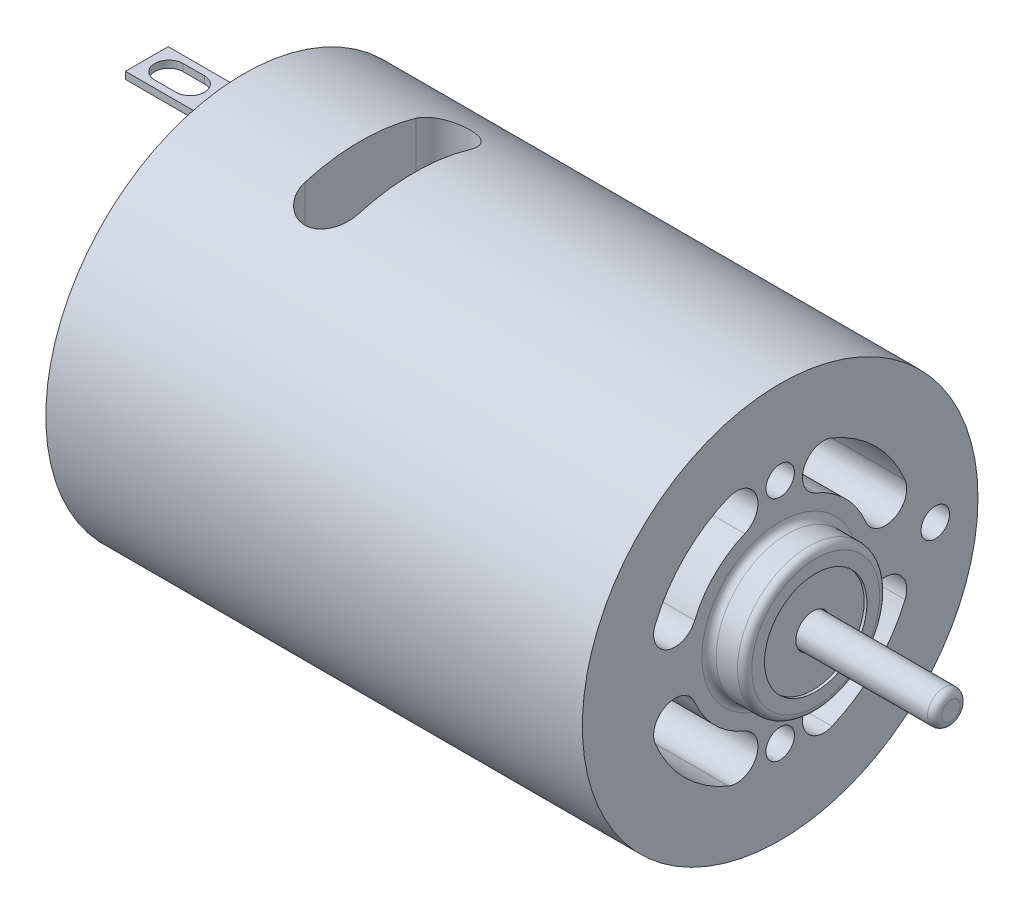
from build123d import *

# Parameters (mm, degrees)
SKETCH_1_R               = 13.9
EXTRUDE_1_DEPTH          = 37.7
CUT_EXTRUDE_1_DEPTH      = 43.517173001
CUT_EXTRUDE_1_DEPTH_BACK = 43.517173001
SKETCH_3_R               = 13.7
CUT_EXTRUDE_2_DEPTH      = 1
EXTRUDE_START            = 1
EXTRUDE_7_DEPTH          = 1
SKETCH_6_4_W             = 3
SKETCH_6_4_H             = 0.5
EXTRUDE_8_DEPTH          = 6.8
CUT_EXTRUDE_4_DEPTH      = 48.482523263
SKETCH_4_W               = 17.082447132
SKETCH_4_H               = 17
EXTRUDE_2_DEPTH          = 1
SKETCH_5_R               = 1.15
EXTRUDE_3_DEPTH          = 4
SKETCH_5_3_R             = 5
EXTRUDE_4_DEPTH          = 2
SKETCH_5_4_R             = 3
EXTRUDE_5_DEPTH          = 3
CUT_EXTRUDE_START        = 1
SKETCH_5_5_R             = 2.25
SKETCH_5_5_R_2           = 1.15
CUT_EXTRUDE_3_DEPTH      = 2
FILLET_1_R               = 1
FILLET_2_R               = 1
FILLET_3_R               = 0.5
EXTRUDE_START_2          = 2.5
SKETCH_8_R               = 5
SKETCH_8_R_2             = 3.6
EXTRUDE_9_DEPTH          = 2.5
EXTRUDE_START_3          = 2.3
SKETCH_8_3_R             = 3.6
SKETCH_8_3_R_2           = 1.2
EXTRUDE_10_DEPTH         = 2.3
EXTRUDE_START_4          = 12
SKETCH_8_4_R             = 1.15
EXTRUDE_11_DEPTH         = 12
FILLET_4_R               = 0.5
FILLET_5_R               = 0.5
FILLET_6_R               = 0.5
SKETCH_9_R               = 1
CUT_EXTRUDE_5_DEPTH      = 10
CUT_EXTRUDE_START_2      = -10
CUT_EXTRUDE_6_DEPTH      = 10
CHAMFER_1_SIZE           = 1


with BuildPart() as part:
    # 草图1 → 凸台-拉伸1 (new body)
    with BuildSketch(Plane(origin=(0, 0, 0), x_dir=(0, 0, -1), z_dir=(1, 0, 0))):
        Circle(SKETCH_1_R)
    extrude(amount=EXTRUDE_1_DEPTH)

    # 草图2 → 切除-拉伸1 (cut, two sides: drawn at the far end of the back side and taken through both)
    with BuildSketch(Plane(origin=(0, 0, 0), x_dir=(1, 0, 0), z_dir=(0, 1, 0)).offset(-CUT_EXTRUDE_1_DEPTH_BACK)):
        with BuildLine():
            Line((12, 3.9), (12, -3.9))
            ThreePointArc((12, -3.9), (10.1, -5.8), (8.2, -3.9))
            Line((8.2, -3.9), (8.2, 3.9))
            ThreePointArc((8.2, 3.9), (10.1, 5.8), (12, 3.9))
        make_face()
    extrude(amount=CUT_EXTRUDE_1_DEPTH + CUT_EXTRUDE_1_DEPTH_BACK, mode=Mode.SUBTRACT)

    # 草图3 → 切除-拉伸2 (cut)
    with BuildSketch(Plane.ZY):
        Circle(SKETCH_3_R)
    extrude(amount=-CUT_EXTRUDE_2_DEPTH, mode=Mode.SUBTRACT)

    # 草图6 → 凸台-拉伸7 (add)
    with BuildSketch(Plane.ZY.offset(-1).offset(EXTRUDE_START)):
        with BuildLine():
            Line((-3.85, -9.1), (-3.85, -13.147908579))
            ThreePointArc((-3.85, -13.147908579), (0, -13.7), (3.85, -13.147908579))
            Line((3.85, -13.147908579), (3.85, -9.1))
            Line((3.85, -9.1), (-3.85, -9.1))
        make_face()
        with BuildLine():
            Line((3.85, 9.1), (3.85, 13.147908579))
            ThreePointArc((3.85, 13.147908579), (0, 13.7), (-3.85, 13.147908579))
            Line((-3.85, 13.147908579), (-3.85, 9.1))
            Line((-3.85, 9.1), (3.85, 9.1))
        make_face()
    extrude(amount=-EXTRUDE_7_DEPTH)

    # 草图6<4> → 凸台-拉伸8 (add)
    with BuildSketch(Plane.ZY.offset(-1).offset(EXTRUDE_START)):
        with Locations((0, -11.15)):
            Rectangle(SKETCH_6_4_W, SKETCH_6_4_H)
        with Locations((0, 11.15)):
            Rectangle(SKETCH_6_4_W, SKETCH_6_4_H)
    extrude(amount=EXTRUDE_8_DEPTH)

    # 草图7 → 切除-拉伸4 (cut, through all)
    with BuildSketch(Plane.XZ.offset(11.4)):
        with BuildLine():
            Line((-5.25, 1), (-3.75, 1))
            ThreePointArc((-3.75, 1), (-2.75, 0), (-3.75, -1))
            Line((-3.75, -1), (-5.25, -1))
            ThreePointArc((-5.25, -1), (-6.25, 0), (-5.25, 1))
        make_face()
    extrude(amount=-CUT_EXTRUDE_4_DEPTH, mode=Mode.SUBTRACT)

    # 草图4 → 凸台-拉伸2 (add)
    with BuildSketch(Plane.ZY.offset(-1)):
        Rectangle(SKETCH_4_W, SKETCH_4_H)
        with BuildLine():
            ThreePointArc((-8.541223566, 8.5), (-12.05, 0), (-8.541223566, -8.5))
            Line((-8.541223566, -8.5), (-8.541223566, 8.5))
        make_face()
        with BuildLine():
            Line((8.541223566, 8.5), (8.541223566, -8.5))
            ThreePointArc((8.541223566, -8.5), (11.138317736, -4.597866681), (12.05, 0))
            ThreePointArc((12.05, 0), (11.138317736, 4.597866681), (8.541223566, 8.5))
        make_face()
    extrude(amount=EXTRUDE_2_DEPTH)

    # 草图5 → 凸台-拉伸3 (add)
    with BuildSketch(Plane.ZY):
        Circle(SKETCH_5_R)
    extrude(amount=EXTRUDE_3_DEPTH)

    # 草图5<3> → 凸台-拉伸4 (add)
    with BuildSketch(Plane.ZY):
        Circle(SKETCH_5_3_R)
    extrude(amount=EXTRUDE_4_DEPTH)

    # 草图5<4> → 凸台-拉伸5 (add)
    with BuildSketch(Plane.ZY):
        Circle(SKETCH_5_4_R)
    extrude(amount=EXTRUDE_5_DEPTH)

    # 草图5<5> → 切除-拉伸3 (cut)
    with BuildSketch(Plane.ZY.offset(CUT_EXTRUDE_START)):
        Circle(SKETCH_5_5_R)
        Circle(SKETCH_5_5_R_2, mode=Mode.SUBTRACT)
    extrude(amount=CUT_EXTRUDE_3_DEPTH, mode=Mode.SUBTRACT)

    # 圆角1
    fillet_1_edges = [part.edges().sort_by_distance(p)[0] for p in [
        (-2, 0, -5),
    ]]
    fillet(fillet_1_edges, radius=FILLET_1_R)

    # 圆角2
    # the kernel refuses this fillet: 1 mm, written as the material it takes off along each edge
    with BuildSketch(Plane(origin=(-3, 0, 0), x_dir=(0, 0, 1), z_dir=(0, -1, 0))) as fillet_2_piece_1:
        with BuildLine():
            CenterArc((2, -0.968245837), FILLET_2_R, 0, 75.522487814)
            Line((2.25, 0), (2.255, 0.019364917))
            ThreePointArc((2.255, 0.019364917), (2.625, 0.02), (3, 0.02))
            Line((3, 0.02), (3.02, 0))
            Line((3.02, 0), (3.02, -0.968245837))
            Line((3.02, -0.968245837), (3, -0.968245837))
        make_face()
    revolve(axis=Axis((-3, 0, 0), (-1, 0, 0)), mode=Mode.SUBTRACT)

    # 圆角3
    fillet_3_edges = [part.edges().sort_by_distance(p)[0] for p in [
        (-4, 0, -1.15),
    ]]
    fillet(fillet_3_edges, radius=FILLET_3_R)

    # 草图8 → 凸台-拉伸9 (add)
    with BuildSketch(Plane(origin=(37.7, 0, 0), x_dir=(0, 0, -1), z_dir=(1, 0, 0)).offset(EXTRUDE_START_2)):
        with Locations(Location((0, 0, 0), (0, 0, 180))):
            Circle(SKETCH_8_R)
        Circle(SKETCH_8_R_2, mode=Mode.SUBTRACT)
    extrude(amount=-EXTRUDE_9_DEPTH)

    # 草图8<3> → 凸台-拉伸10 (add)
    with BuildSketch(Plane(origin=(37.7, 0, 0), x_dir=(0, 0, -1), z_dir=(1, 0, 0)).offset(EXTRUDE_START_3)):
        Circle(SKETCH_8_3_R)
        Circle(SKETCH_8_3_R_2, mode=Mode.SUBTRACT)
    extrude(amount=-EXTRUDE_10_DEPTH)

    # 草图8<4> → 凸台-拉伸11 (add)
    with BuildSketch(Plane(origin=(37.7, 0, 0), x_dir=(0, 0, -1), z_dir=(1, 0, 0)).offset(EXTRUDE_START_4)):
        with Locations(Location((0, 0, 0), (0, 0, 180))):
            Circle(SKETCH_8_4_R)
    extrude(amount=-EXTRUDE_11_DEPTH)

    # 圆角4
    fillet_4_edges = [part.edges().sort_by_distance(p)[0] for p in [
        (49.7, 0, -1.15),
    ]]
    fillet(fillet_4_edges, radius=FILLET_4_R)

    # 圆角5
    fillet_5_edges = [part.edges().sort_by_distance(p)[0] for p in [
        (40.2, 0, -5),
    ]]
    fillet(fillet_5_edges, radius=FILLET_5_R)

    # 圆角6
    fillet_6_edges = [part.edges().sort_by_distance(p)[0] for p in [
        (37.7, 0, -5),
    ]]
    fillet(fillet_6_edges, radius=FILLET_6_R)

    # 草图9 → 切除-拉伸5 (cut)
    with BuildSketch(Plane(origin=(37.7, 0, 0), x_dir=(0, 0, -1), z_dir=(1, 0, 0))):
        with BuildLine():
            ThreePointArc((2.487442249, 6.005216987), (4.596194074, 4.596194082), (6.005216982, 2.48744226))
            ThreePointArc((6.005216982, 2.48744226), (7.965061461, 1.675648182), (8.776855536, 3.635492661))
            ThreePointArc((8.776855536, 3.635492661), (6.7175144, 6.717514442), (3.635492607, 8.776855559))
            ThreePointArc((3.635492607, 8.776855559), (1.675648173, 7.965061439), (2.487442249, 6.005216987))
        make_face()
        with BuildLine():
            ThreePointArc((6.005216945, -2.48744235), (4.596194039, -4.596194116), (2.487442249, -6.005216987))
            ThreePointArc((2.487442249, -6.005216987), (1.675648184, -7.965061466), (3.635492661, -8.776855536))
            ThreePointArc((3.635492661, -8.776855536), (6.717514416, -6.717514426), (8.776855531, -3.635492674))
            ThreePointArc((8.776855531, -3.635492674), (7.965061422, -1.675648166), (6.005216945, -2.48744235))
        make_face()
        with BuildLine():
            ThreePointArc((-6.005216994, 2.487442232), (-4.596194128, 4.596194027), (-2.487442365, 6.005216939))
            ThreePointArc((-2.487442365, 6.005216939), (-1.67564816, 7.965061408), (-3.635492661, 8.776855536))
            ThreePointArc((-3.635492661, 8.776855536), (-6.717514442, 6.7175144), (-8.776855559, 3.635492607))
            ThreePointArc((-8.776855559, 3.635492607), (-7.965061447, 1.675648176), (-6.005216994, 2.487442232))
        make_face()
        with BuildLine():
            ThreePointArc((-2.487442378, -6.005216933), (-4.596194133, -4.596194022), (-6.005216994, -2.487442232))
            ThreePointArc((-6.005216994, -2.487442232), (-7.965061447, -1.675648176), (-8.776855559, -3.635492607))
            ThreePointArc((-8.776855559, -3.635492607), (-6.717514442, -6.7175144), (-3.635492662, -8.776855536))
            ThreePointArc((-3.635492662, -8.776855536), (-1.675648157, -7.965061402), (-2.487442378, -6.005216933))
        make_face()
        with Locations((0, 8)):
            Circle(SKETCH_9_R)
        with Locations((0, -8)):
            Circle(SKETCH_9_R)
        with Locations((10.9, 0)):
            Circle(SKETCH_9_R)
    extrude(amount=-CUT_EXTRUDE_5_DEPTH, mode=Mode.SUBTRACT)

    # 草图11 → 切除-拉伸6 (cut)
    with BuildSketch(Plane.ZY.offset(CUT_EXTRUDE_START_2)):
        with BuildLine():
            Line((-7.25, 7.25), (-7.25, 2.8))
            Line((-7.25, 2.8), (-5.86600375, 2.8))
            ThreePointArc((-5.86600375, 2.8), (-4.596194078, 4.596194078), (-2.8, 5.86600375))
            Line((-2.8, 5.86600375), (-2.8, 7.25))
            Line((-2.8, 7.25), (-7.25, 7.25))
        make_face()
        with BuildLine():
            Line((2.8, 7.25), (2.8, 5.86600375))
            ThreePointArc((2.8, 5.86600375), (4.596194078, 4.596194078), (5.86600375, 2.8))
            Line((5.86600375, 2.8), (7.25, 2.8))
            Line((7.25, 2.8), (7.25, 7.25))
            Line((7.25, 7.25), (2.8, 7.25))
        make_face()
        with BuildLine():
            ThreePointArc((5.86600375, -2.8), (4.596194078, -4.596194078), (2.8, -5.86600375))
            Line((2.8, -5.86600375), (2.8, -7.25))
            Line((2.8, -7.25), (7.25, -7.25))
            Line((7.25, -7.25), (7.25, -2.8))
            Line((7.25, -2.8), (5.86600375, -2.8))
        make_face()
        with BuildLine():
            Line((-5.86600375, -2.8), (-7.25, -2.8))
            Line((-7.25, -2.8), (-7.25, -7.25))
            Line((-7.25, -7.25), (-2.8, -7.25))
            Line((-2.8, -7.25), (-2.8, -5.86600375))
            ThreePointArc((-2.8, -5.86600375), (-4.596194078, -4.596194078), (-5.86600375, -2.8))
        make_face()
    extrude(amount=CUT_EXTRUDE_6_DEPTH, mode=Mode.SUBTRACT)

    # 倒角1
    chamfer_1_edges = [part.edges().sort_by_distance(p)[0] for p in [
        (5, -7.25, -7.25),
        (5, -7.25, 7.25),
        (5, 7.25, 7.25),
        (5, 7.25, -7.25),
    ]]
    chamfer(chamfer_1_edges, length=CHAMFER_1_SIZE)


solid = part.part
